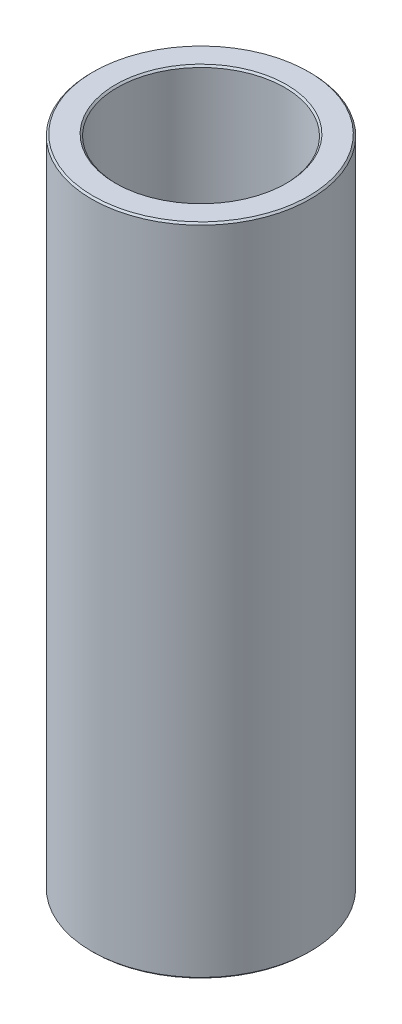
from build123d import *

# Parameters (mm, degrees)
SKETCH1_R           = 20
BOSS_EXTRUDE1_DEPTH = 119.704415854
SKETCH2_R           = 15.321453704
CUT_EXTRUDE1_DEPTH  = 124.000598271
CHAMFER1_SIZE       = 0.311713244


with BuildPart() as part:
    # Sketch1 → Boss-Extrude1 (new body)
    with BuildSketch(Plane(origin=(0, 0, 0), x_dir=(1, 0, 0), z_dir=(0, 1, 0))):
        Circle(SKETCH1_R)
    extrude(amount=BOSS_EXTRUDE1_DEPTH)

    # Sketch2 → Cut-Extrude1 (cut, through all)
    with BuildSketch(Plane(origin=(0, 0, 0), x_dir=(1, 0, 0), z_dir=(0, 1, 0))):
        Circle(SKETCH2_R)
    extrude(amount=CUT_EXTRUDE1_DEPTH, mode=Mode.SUBTRACT)

    # Chamfer1
    chamfer1_edges = [part.edges().sort_by_distance(p)[0] for p in [
        (-15.321453704, 119.704415854, 0),
        (-15.321453704, 0, 0),
        (-20, 0, 0),
        (-20, 119.704415854, 0),
    ]]
    chamfer(chamfer1_edges, length=CHAMFER1_SIZE)


solid = part.part
